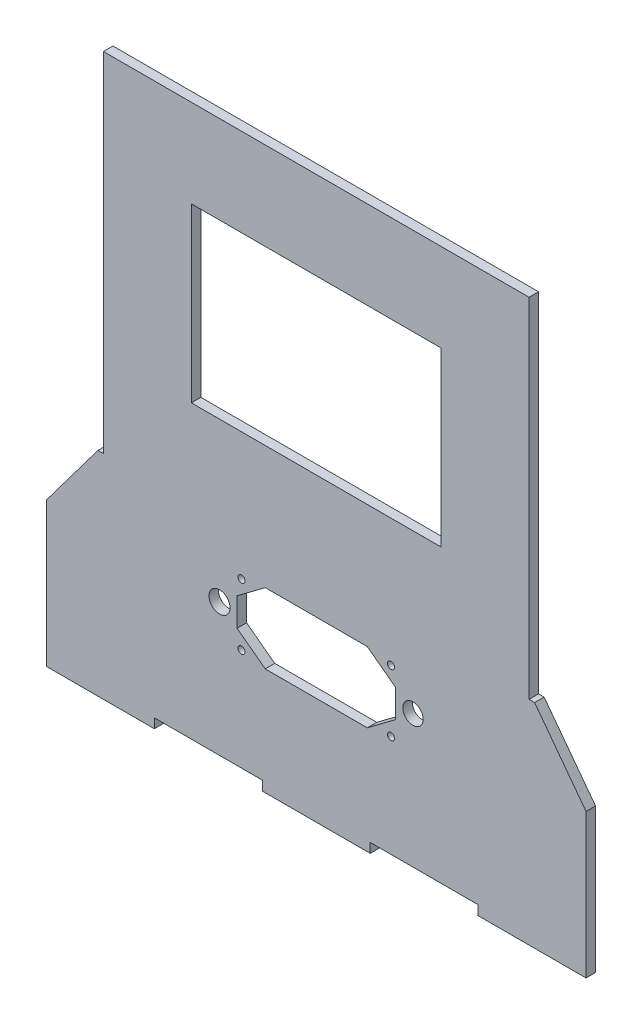
from build123d import *

# Parameters (mm, degrees)
SKETCH1_R           = 1
SKETCH1_R_2         = 3
SKETCH1_R_3         = 2.9
SKETCH1_W           = 71
SKETCH1_H           = 49
BOSS_EXTRUDE3_DEPTH = 2.7


with BuildPart() as part:
    # Sketch1 → Boss-Extrude3 (new body)
    with BuildSketch(Plane.XY):
        Polygon((-76.7, 13), (-62.075, 32.5), (-60.5, 32.5), (-60.5, 131.5), (60.5, 131.5), (60.5, 32.5), (62.075, 32.5), (76.7, 13), (76.7, -23), (76.7, -25.3), (76.7, -28), (46.02, -28), (46.02, -25.3), (15.34, -25.3), (15.34, -28), (-15.34, -28), (-15.34, -25.3), (-46.02, -25.3), (-46.02, -28), (-76.7, -28), (-76.7, -25.3), (-76.7, -23), align=None)
        with Locations((-21.25, 3.75)):
            Circle(SKETCH1_R, mode=Mode.SUBTRACT)
        with Locations((-27.5, 12.5)):
            Circle(SKETCH1_R_2, mode=Mode.SUBTRACT)
        with Locations((-21.25, 21.25)):
            Circle(SKETCH1_R, mode=Mode.SUBTRACT)
        with Locations((21.25, 3.75)):
            Circle(SKETCH1_R, mode=Mode.SUBTRACT)
        with Locations((27.5, 12.5)):
            Circle(SKETCH1_R_3, mode=Mode.SUBTRACT)
        with Locations((21.25, 21.25)):
            Circle(SKETCH1_R, mode=Mode.SUBTRACT)
        Polygon((-22.5, 16.5), (-14.5, 22.5), (14.5, 22.5), (22.5, 16.5), (22.5, 8.5), (14.5, 2.5), (0, 2.5), (-14.5, 2.5), (-22.5, 8.5), align=None, mode=Mode.SUBTRACT)
        with Locations((0, 82)):
            Rectangle(SKETCH1_W, SKETCH1_H, mode=Mode.SUBTRACT)
    extrude(amount=BOSS_EXTRUDE3_DEPTH)


solid = part.part
